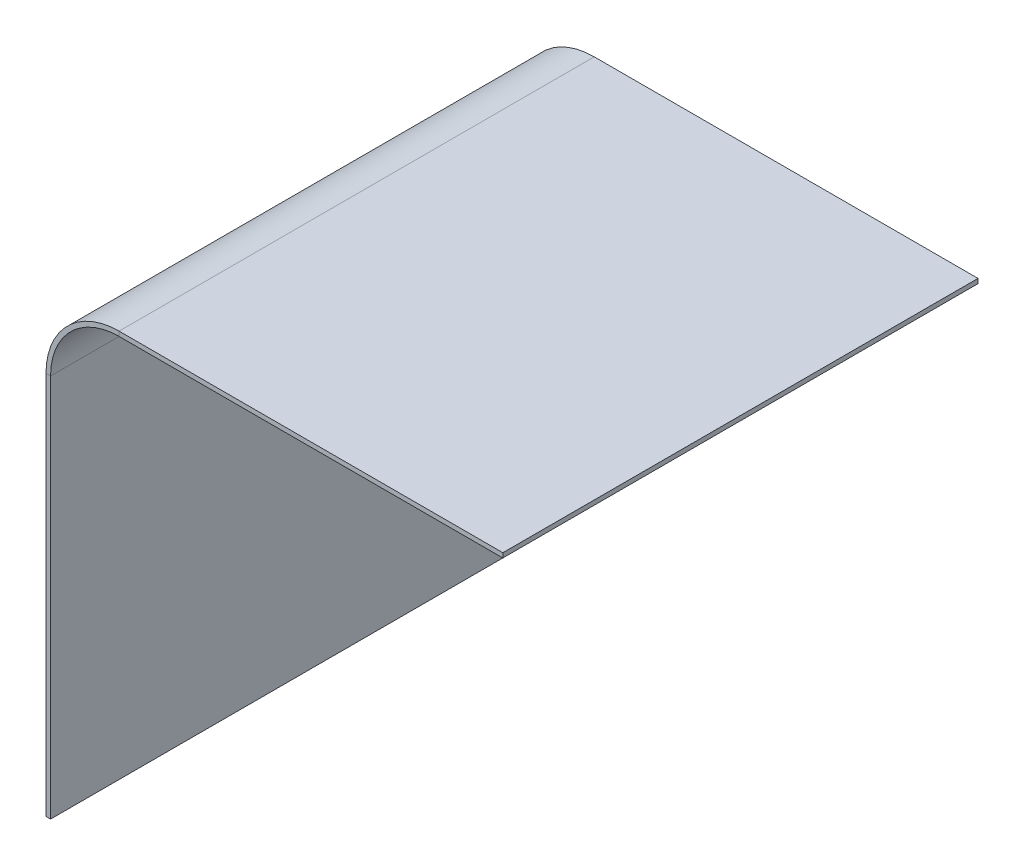
from build123d import *

# Parameters (mm, degrees)
BASE_FLANGE1_DEPTH = 104


# Sheet-metal steps are written as plain solids
with BuildPart() as part:
    # Sketch1 → Base-Flange1 (new body)
    with BuildSketch(Plane.XY):
        with BuildLine():
            Line((99, 99), (15, 99))
            ThreePointArc((15, 99), (4.393398282, 94.606601718), (0, 84))
            Line((0, 84), (0, 0))
            Line((0, 0), (-1, 0))
            Line((-1, 0), (-1, 84))
            ThreePointArc((-1, 84), (3.686291501, 95.313708499), (15, 100))
            Line((15, 100), (99, 100))
            Line((99, 100), (99, 99))
        make_face()
    extrude(amount=BASE_FLANGE1_DEPTH)


solid = part.part
